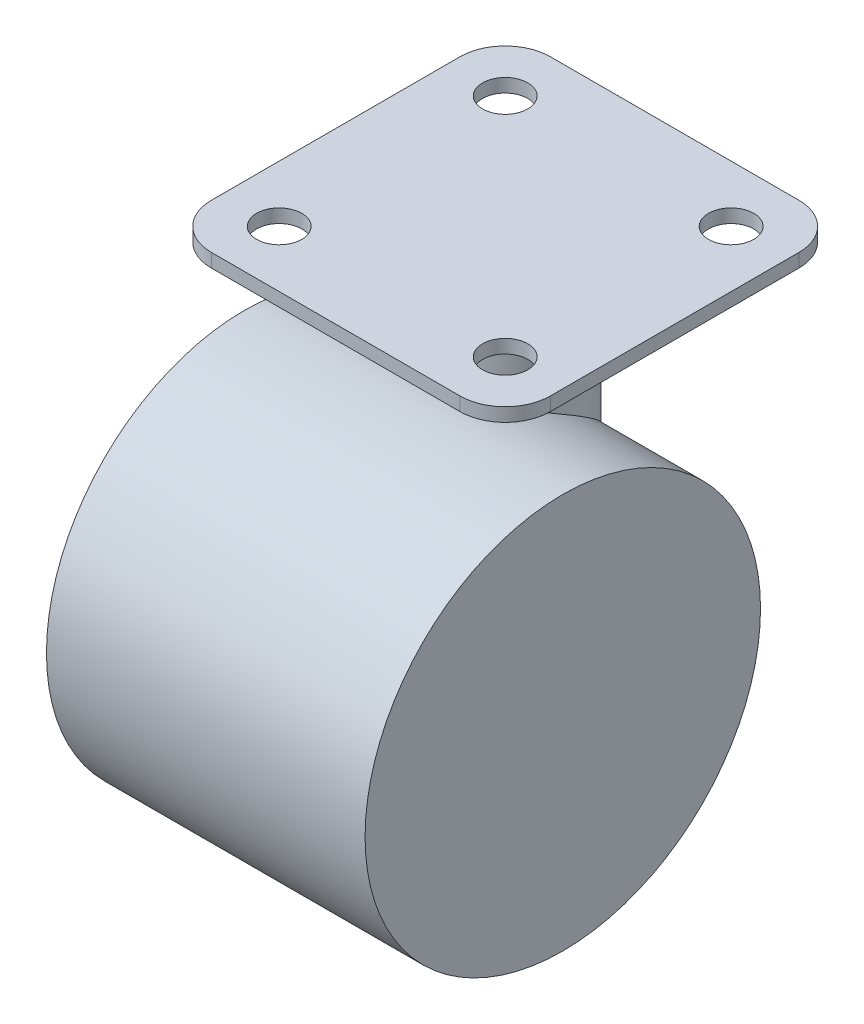
from build123d import *

# Parameters (mm, degrees)
SKETCH_1_W              = 30
SKETCH_1_H              = 30
EXTRUDE_401_DEPTH       = 0.6
SKETCH_7_R              = 2
CUT_EXTRUDE_589_DEPTH   = 22.247117452
FILLET_4_R              = 4
SKETCH_9_R              = 17.5
EXTRUDE_963_DEPTH       = 14.1
EXTRUDE_1165_REACH      = 54.527
EXTRUDE_1165_END_RADIUS = 17.5
SKETCH_8_R              = 6


with BuildPart() as part:
    # Эскиз1 → Extrude 401 (new, symmetric)
    with BuildSketch(Plane(origin=(0, 0, 0), x_dir=(1, 0, 0), z_dir=(0, 1, 0))):
        Rectangle(SKETCH_1_W, SKETCH_1_H)
    extrude(amount=EXTRUDE_401_DEPTH, both=True)

    # Эскиз7 → Cut-Extrude 589 (cut, through all)
    with BuildSketch(Plane(origin=(0, 0.6, 0), x_dir=(1, 0, 0), z_dir=(0, 1, 0))):
        with Locations((-10, 10)):
            Circle(SKETCH_7_R)
        with Locations((10, 10)):
            Circle(SKETCH_7_R)
        with Locations((10, -10)):
            Circle(SKETCH_7_R)
        with Locations((-10, -10)):
            Circle(SKETCH_7_R)
    extrude(amount=-CUT_EXTRUDE_589_DEPTH, mode=Mode.SUBTRACT)

    # Скругление4
    fillet_4_edges = [part.edges().sort_by_distance(p)[0] for p in [
        (15, 0, -15),
        (15, 0, 15),
        (-15, 0, 15),
        (-15, 0, -15),
    ]]
    fillet(fillet_4_edges, radius=FILLET_4_R)

    # Extrude 1165: up to this cylinder (the profile starts outside it)
    extrude_1165_end = Plane(origin=(0, -25.9, 9), z_dir=(-1, 0, 0)) * Cylinder(EXTRUDE_1165_END_RADIUS, 145.054, mode=Mode.PRIVATE)
    # Эскиз8 → Extrude 1165 (add, up to the surface)
    with BuildSketch(Plane.XZ.offset(0.6), mode=Mode.PRIVATE) as extrude_1165_sk1:
        Circle(SKETCH_8_R)
    extrude_1165_tool1 = extrude(extrude_1165_sk1.sketch, amount=EXTRUDE_1165_REACH, mode=Mode.PRIVATE) - extrude_1165_end
    add(extrude_1165_tool1.solids().sort_by_distance((0, -0.6, 0))[0])


with BuildPart() as body_2:
    # Эскиз9 → Extrude 963 (new, symmetric)
    with BuildSketch(Plane(origin=(0, 0, 0), x_dir=(0, 0, -1), z_dir=(1, 0, 0))):
        with Locations((-9, -25.9)):
            Circle(SKETCH_9_R)
    extrude(amount=EXTRUDE_963_DEPTH, both=True)


solid = Compound([part.part, body_2.part])
